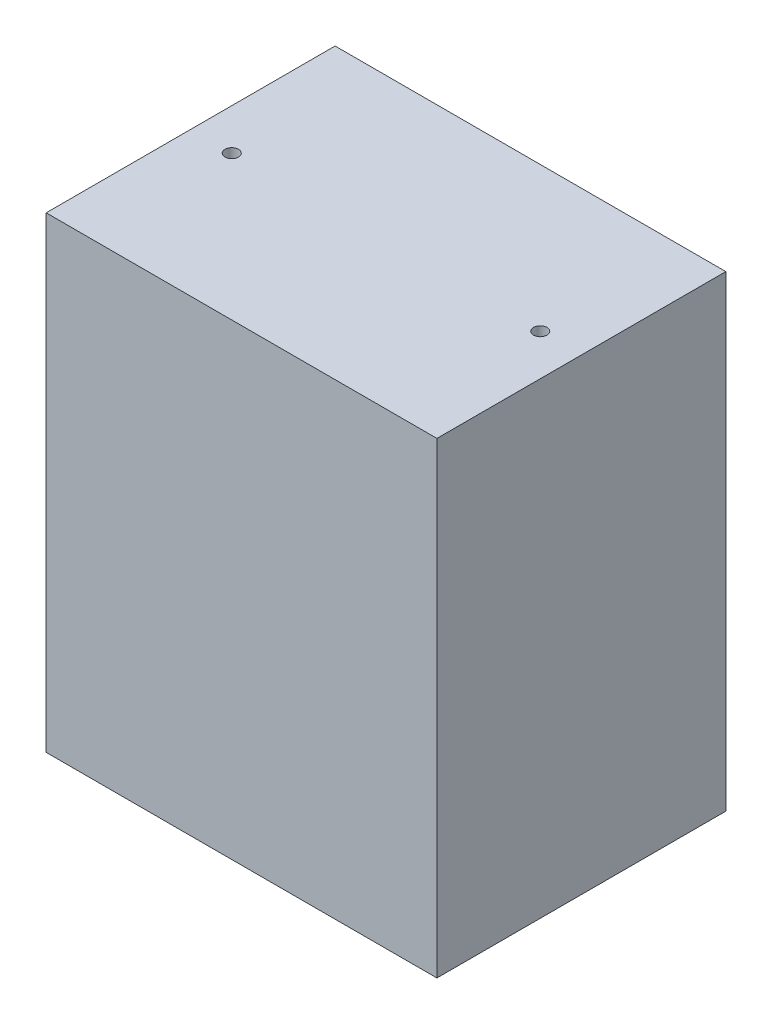
from build123d import *

# Parameters (mm, degrees)
SKETCH1_W           = 81.14466971
SKETCH1_H           = 97.04414292
BOSS_EXTRUDE1_DEPTH = 60
SKETCH2_R           = 1.4
CUT_EXTRUDE1_DEPTH  = 20


with BuildPart() as part:
    # Sketch1 → Boss-Extrude1 (new body)
    with BuildSketch(Plane.XY):
        Rectangle(SKETCH1_W, SKETCH1_H)
    extrude(amount=BOSS_EXTRUDE1_DEPTH)

    # Sketch2 → Cut-Extrude1 (cut)
    with BuildSketch(Plane(origin=(0, 48.52207146, 0), x_dir=(1, 0, 0), z_dir=(0, 1, 0))):
        with Locations((-32.032334855, -30)):
            Circle(SKETCH2_R)
        with Locations((32.032027822, -30)):
            Circle(SKETCH2_R)
    extrude(amount=-CUT_EXTRUDE1_DEPTH, mode=Mode.SUBTRACT)


solid = part.part
